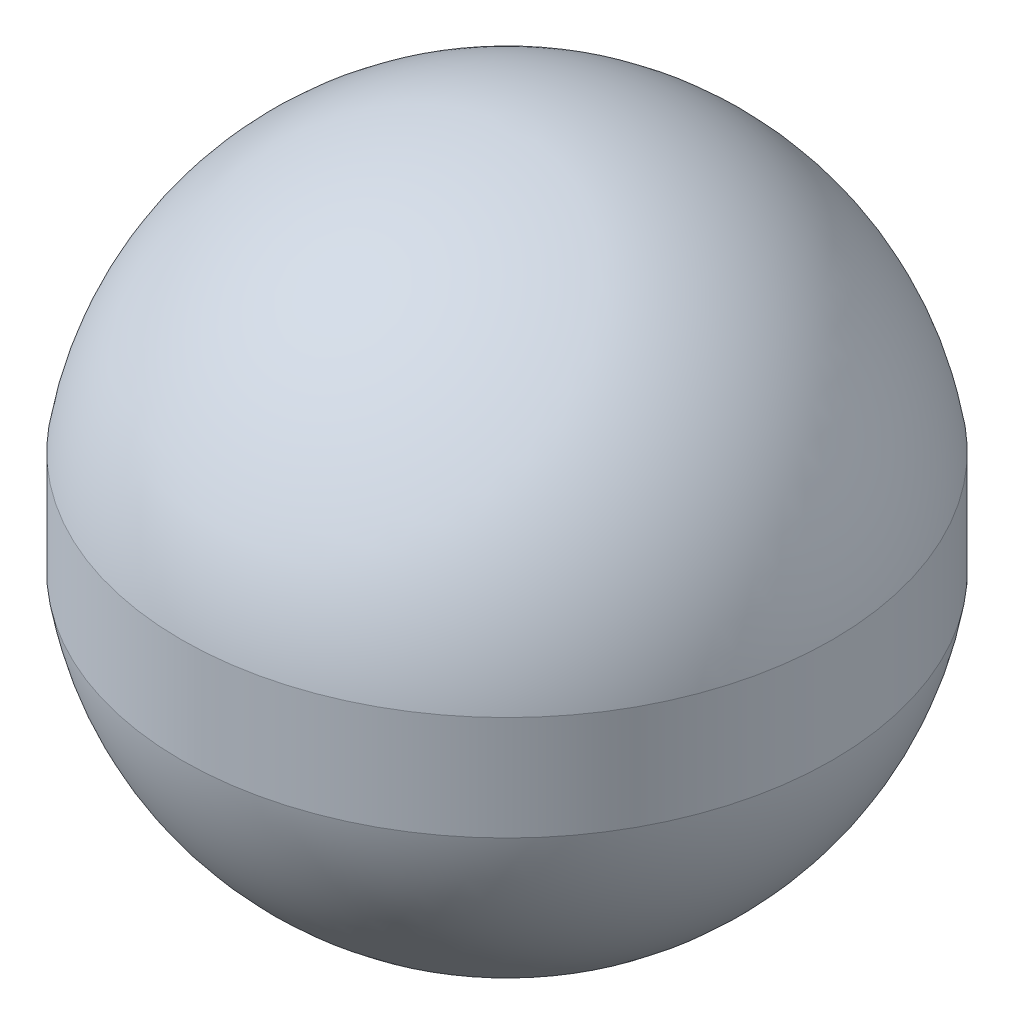
from build123d import *


with BuildPart() as part:
    # Sketch1 → Revolve1 (revolve)
    with BuildSketch(Plane.XY):
        with BuildLine():
            ThreePointArc((7.8375, 1.255985669), (5.149491237, 6.040417721), (0, 7.9375))
            Line((0, 7.9375), (0, -7.9365))
            Line((0, -7.9365), (0.125992063, -7.9365))
            ThreePointArc((0.125992063, -7.9365), (5.197270379, -5.999357204), (7.8375, -1.255985669))
            Line((7.8375, -1.255985669), (7.8375, 1.255985669))
        make_face()
    revolve(axis=Axis((0, 7.9375, 0), (0, -1, 0)))


solid = part.part
